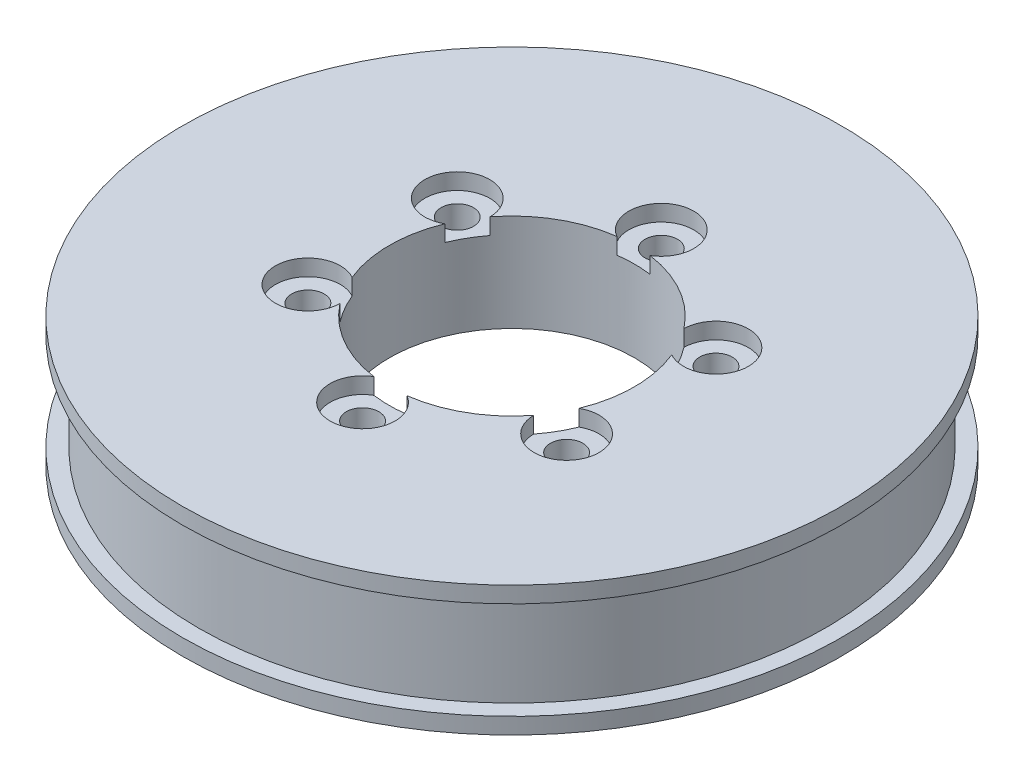
from build123d import *

# Parameters (mm, degrees)
SKETCH2_R           = 19.3
SKETCH2_R_2         = 17.8
BOSS_EXTRUDE1_DEPTH = 8
SKETCH2_3_R         = 20.3
SKETCH2_3_R_2       = 19.3
BOSS_EXTRUDE2_DEPTH = 1
BOSS_EXTRUDE3_START = 7
SKETCH2_4_R         = 20.3
SKETCH2_4_R_2       = 19.3
BOSS_EXTRUDE3_DEPTH = 1
BOSS_EXTRUDE4_START = -2
SKETCH3_R           = 17.8
SKETCH3_R_2         = 7.55
BOSS_EXTRUDE4_DEPTH = 2
BOSS_EXTRUDE5_START = 4
SKETCH4_R           = 11.25
SKETCH4_R_2         = 7.55
SKETCH4_R_3         = 1
BOSS_EXTRUDE5_DEPTH = 4
SKETCH5_R           = 1
CUT_EXTRUDE1_DEPTH  = 6
SKETCH6_R           = 2
CUT_EXTRUDE2_DEPTH  = 1
FILLET1_SIZE        = 2


with BuildPart() as part:
    # Sketch2 → Boss-Extrude1 (new body)
    with BuildSketch(Plane(origin=(0, 0, 0), x_dir=(1, 0, 0), z_dir=(0, 1, 0))):
        with Locations(Location((0, 0, 0), (0, 0, 270))):
            Circle(SKETCH2_R)
        with Locations(Location((0, 0, 0), (0, 0, 270))):
            Circle(SKETCH2_R_2, mode=Mode.SUBTRACT)
    extrude(amount=BOSS_EXTRUDE1_DEPTH)

    # Sketch2<3> → Boss-Extrude2 (add)
    with BuildSketch(Plane(origin=(0, 0, 0), x_dir=(1, 0, 0), z_dir=(0, 1, 0))):
        with Locations(Location((0, 0, 0), (0, 0, 270))):
            Circle(SKETCH2_3_R)
        with Locations(Location((0, 0, 0), (0, 0, 270))):
            Circle(SKETCH2_3_R_2, mode=Mode.SUBTRACT)
    extrude(amount=BOSS_EXTRUDE2_DEPTH)

    # Sketch2<4> → Boss-Extrude3 (add)
    with BuildSketch(Plane(origin=(0, 0, 0), x_dir=(1, 0, 0), z_dir=(0, 1, 0)).offset(BOSS_EXTRUDE3_START)):
        with Locations(Location((0, 0, 0), (0, 0, 270))):
            Circle(SKETCH2_4_R)
        with Locations(Location((0, 0, 0), (0, 0, 270))):
            Circle(SKETCH2_4_R_2, mode=Mode.SUBTRACT)
    extrude(amount=BOSS_EXTRUDE3_DEPTH)

    # Sketch3 → Boss-Extrude4 (add)
    with BuildSketch(Plane(origin=(0, 8, 0), x_dir=(1, 0, 0), z_dir=(0, 1, 0)).offset(BOSS_EXTRUDE4_START)):
        with Locations(Location((0, 0, 0), (0, 0, 270))):
            Circle(SKETCH3_R)
        with Locations(Location((0, 0, 0), (0, 0, 270))):
            Circle(SKETCH3_R_2, mode=Mode.SUBTRACT)
    extrude(amount=BOSS_EXTRUDE4_DEPTH)

    # Sketch4 → Boss-Extrude5 (add)
    with BuildSketch(Plane.XZ.offset(-6).offset(BOSS_EXTRUDE5_START)):
        with Locations(Location((0, 0, 0), (0, 0, 90))):
            Circle(SKETCH4_R)
        with Locations(Location((0, 0, 0), (0, 0, 90))):
            Circle(SKETCH4_R_2, mode=Mode.SUBTRACT)
        with Locations(Location((0, 9.2, 0), (0, 0, 270))):
            Circle(SKETCH4_R_3, mode=Mode.SUBTRACT)
        with Locations(Location((7.967433715, 4.6, 0), (0, 0, 270))):
            Circle(SKETCH4_R_3, mode=Mode.SUBTRACT)
        with Locations(Location((7.967433715, -4.6, 0), (0, 0, 270))):
            Circle(SKETCH4_R_3, mode=Mode.SUBTRACT)
        with Locations(Location((0, -9.2, 0), (0, 0, 270))):
            Circle(SKETCH4_R_3, mode=Mode.SUBTRACT)
        with Locations(Location((-7.967433715, -4.6, 0), (0, 0, 270))):
            Circle(SKETCH4_R_3, mode=Mode.SUBTRACT)
        with Locations(Location((-7.967433715, 4.6, 0), (0, 0, 270))):
            Circle(SKETCH4_R_3, mode=Mode.SUBTRACT)
    extrude(amount=-BOSS_EXTRUDE5_DEPTH)

    # Sketch5 → Cut-Extrude1 (cut)
    with BuildSketch(Plane.XZ.offset(-2)):
        with Locations(Location((0, 9.2, 0), (0, 0, 90))):
            Circle(SKETCH5_R)
        with Locations(Location((7.967433715, 4.6, 0), (0, 0, 90))):
            Circle(SKETCH5_R)
        with Locations(Location((7.967433715, -4.6, 0), (0, 0, 90))):
            Circle(SKETCH5_R)
        with Locations(Location((0, -9.2, 0), (0, 0, 90))):
            Circle(SKETCH5_R)
        with Locations(Location((-7.967433715, -4.6, 0), (0, 0, 90))):
            Circle(SKETCH5_R)
        with Locations(Location((-7.967433715, 4.6, 0), (0, 0, 90))):
            Circle(SKETCH5_R)
    extrude(amount=-CUT_EXTRUDE1_DEPTH, mode=Mode.SUBTRACT)

    # Sketch6 → Cut-Extrude2 (cut)
    with BuildSketch(Plane(origin=(0, 8, 0), x_dir=(1, 0, 0), z_dir=(0, 1, 0))):
        with Locations((0, -9.2)):
            Circle(SKETCH6_R)
        with Locations((-7.967433715, -4.6)):
            Circle(SKETCH6_R)
        with Locations((-7.967433715, 4.6)):
            Circle(SKETCH6_R)
        with Locations((0, 9.2)):
            Circle(SKETCH6_R)
        with Locations((7.967433715, 4.6)):
            Circle(SKETCH6_R)
        with Locations((7.967433715, -4.6)):
            Circle(SKETCH6_R)
    extrude(amount=-CUT_EXTRUDE2_DEPTH, mode=Mode.SUBTRACT)

    # Fillet1
    # a fillet whose section is not a circle: 2 mm, written as the material it adds along each edge
    with BuildSketch(Plane(origin=(0, 6, 0), x_dir=(0, 0, 1), z_dir=(-1, 0, 0))) as fillet1_piece_1:
        with BuildLine():
            Bezier((17.8, -FILLET1_SIZE), (17.8, 0), (17.8 - FILLET1_SIZE, 0), weights=[1, 0.19047619, 1])
            Line((17.8 - FILLET1_SIZE, 0), (17.8, 0))
            Line((17.8, 0), (17.8, -FILLET1_SIZE))
        make_face()
    revolve(axis=Axis((0, 6, 0), (0, 1, 0)))
    with BuildSketch(Plane(origin=(0, 6, 0), x_dir=(0, 0, 1), z_dir=(1, 0, 0))) as fillet1_piece_2:
        with BuildLine():
            Bezier((11.25 + FILLET1_SIZE, 0), (11.25, 0), (11.25, FILLET1_SIZE), weights=[1, 0.19047619, 1])
            Line((11.25, FILLET1_SIZE), (11.25, 0))
            Line((11.25, 0), (11.25 + FILLET1_SIZE, 0))
        make_face()
    revolve(axis=Axis((0, 6, 0), (0, -1, 0)))


solid = part.part
